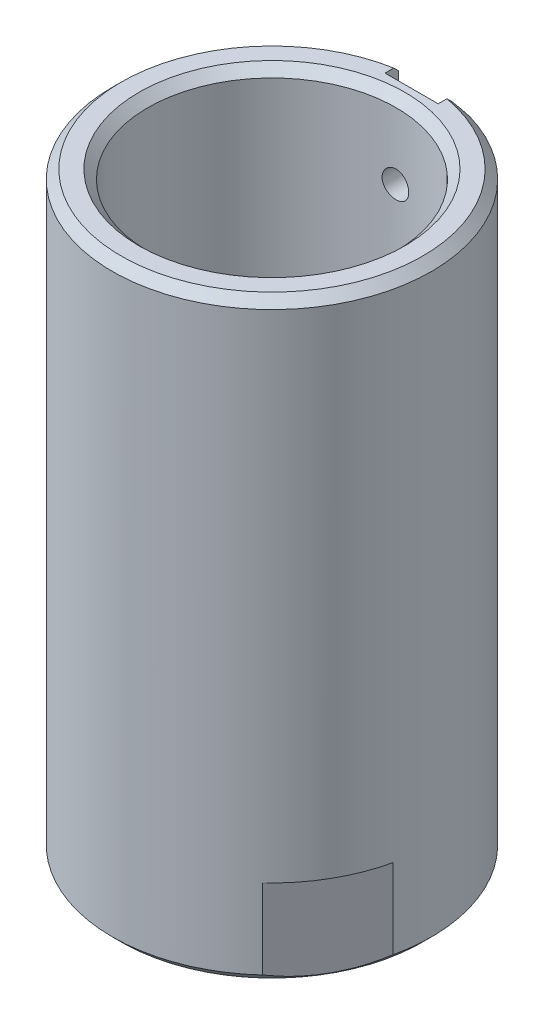
from build123d import *

# Parameters (mm, degrees)
ESQUISSE1_R                  = 9
ESQUISSE1_R_2                = 7
BOSS_EXTRU_1_DEPTH           = 33.5
ENL_V_MAT_EXTRU_1_DEPTH      = 5
ESQUISSE3_R                  = 1
ENL_V_MAT_EXTRU_2_DEPTH      = 1.65725
ENL_V_START                  = -3
ENL_V_MAT_EXTRU_6_DEPTH      = 3
ENL_V_START_2                = -5.5
ENL_V_MAT_EXTRU_3_DEPTH      = 5.5
ENL_V_MAT_EXTRU_4_REACH      = 40.918
ENL_V_MAT_EXTRU_4_END_RADIUS = 7
ESQUISSE5_R                  = 0.75
CHANFREIN2_SIZE              = 0.5


with BuildPart() as part:
    # Esquisse1 → Boss.-Extru.1 (new body)
    with BuildSketch(Plane(origin=(0, 0, 0), x_dir=(1, 0, 0), z_dir=(0, 1, 0))):
        with Locations(Location((0, 0, 0), (0, 0, 270))):
            Circle(ESQUISSE1_R)
        with Locations(Location((0, 0, 0), (0, 0, 270))):
            Circle(ESQUISSE1_R_2, mode=Mode.SUBTRACT)
    extrude(amount=BOSS_EXTRU_1_DEPTH)

    # Esquisse2 → Enlèv. mat.-Extru.1 (cut)
    with BuildSketch(Plane.XZ):
        with BuildLine():
            Line((2.7, -8.585452813), (-2.7, -8.585452813))
            ThreePointArc((-2.7, -8.585452813), (0, -9), (2.7, -8.585452813))
        make_face()
        with BuildLine():
            Line((-8.785220239, 1.954457816), (-6.085220239, 6.630994997))
            ThreePointArc((-6.085220239, 6.630994997), (-7.794228634, 4.5), (-8.785220239, 1.954457816))
        make_face()
        with BuildLine():
            Line((6.085220239, 6.630994997), (8.785220239, 1.954457816))
            ThreePointArc((8.785220239, 1.954457816), (7.794228634, 4.5), (6.085220239, 6.630994997))
        make_face()
    extrude(amount=-ENL_V_MAT_EXTRU_1_DEPTH, mode=Mode.SUBTRACT)

    # Esquisse3 → Enlèv. mat.-Extru.2 (cut)
    with BuildSketch(Plane(origin=(-7.435220239, 0, 4.292726406), x_dir=(-0.49999999999999967, 0, -0.8660254037844389), z_dir=(0.8660254037844389, 0, -0.49999999999999967))):
        with Locations(Location((0, 2.5, 0), (0, 0, 180))):
            Circle(ESQUISSE3_R)
    extrude(amount=ENL_V_MAT_EXTRU_2_DEPTH, mode=Mode.SUBTRACT)

    # Esquisse8 → Enlèv. mat.-Extru.6 (cut)
    with BuildSketch(Plane(origin=(0, 33.5, 0), x_dir=(1, 0, 0), z_dir=(0, 1, 0)).offset(ENL_V_START)):
        with BuildLine():
            Line((-1.5, 8.874119675), (-1.5, 7.874119675))
            Line((-1.5, 7.874119675), (1.5, 7.874119675))
            Line((1.5, 7.874119675), (1.5, 8.874119675))
            ThreePointArc((1.5, 8.874119675), (0, 9), (-1.5, 8.874119675))
        make_face()
    extrude(amount=ENL_V_MAT_EXTRU_6_DEPTH, mode=Mode.SUBTRACT)

    # Esquisse4 → Enlèv. mat.-Extru.3 (cut)
    with BuildSketch(Plane(origin=(0, 33.5, 0), x_dir=(1, 0, 0), z_dir=(0, 1, 0)).offset(ENL_V_START_2)):
        with BuildLine():
            Line((2.5, 8.645808233), (-2.5, 8.645808233))
            ThreePointArc((-2.5, 8.645808233), (0, 9), (2.5, 8.645808233))
        make_face()
    extrude(amount=ENL_V_MAT_EXTRU_3_DEPTH, mode=Mode.SUBTRACT)

    # Enlèv. mat.-Extru.4: up to this cylinder (the profile starts outside it)
    enl_v_mat_extru_4_end = Plane(origin=(0, 29.25, 0), z_dir=(0, -1, 0)) * Cylinder(ENL_V_MAT_EXTRU_4_END_RADIUS, 96.836, mode=Mode.PRIVATE)
    # Esquisse5 → Enlèv. mat.-Extru.4 (cut, up to the surface)
    with BuildSketch(Plane(origin=(0, 0, -8.645808233), x_dir=(-1, 0, 0), z_dir=(0, 0, -1)), mode=Mode.PRIVATE) as enl_v_mat_extru_4_sk1:
        with Locations((0, 29.25)):
            Circle(ESQUISSE5_R)
    enl_v_mat_extru_4_tool1 = extrude(enl_v_mat_extru_4_sk1.sketch, amount=-ENL_V_MAT_EXTRU_4_REACH, mode=Mode.PRIVATE) - enl_v_mat_extru_4_end
    add(enl_v_mat_extru_4_tool1.solids().sort_by_distance((0, 29.25, -8.645808))[0], mode=Mode.SUBTRACT)

    # Chanfrein1: read off the stored shape, not the designer's step
    # Chanfrein1 outline → Chanfrein1 (revolve, cut)
    with BuildSketch(Plane.XY):
        Polygon((7, 33.5), (7, 33), (7.5, 33.5), align=None)
        Polygon((9.000000072, 33.5), (8.5, 33.5), (9, 33), align=None)
        Polygon((9.000000072, 0), (9.000000072, 0.500000072), (8.5, 0), align=None)
    revolve(axis=Axis((0, 0, 0), (0, 1, 0)), mode=Mode.SUBTRACT)

    # Chanfrein2
    chanfrein2_edges = [part.edges().sort_by_distance(p)[0] for p in [
        (0, 0, -7),
    ]]
    chamfer(chanfrein2_edges, length=CHANFREIN2_SIZE)


solid = part.part
